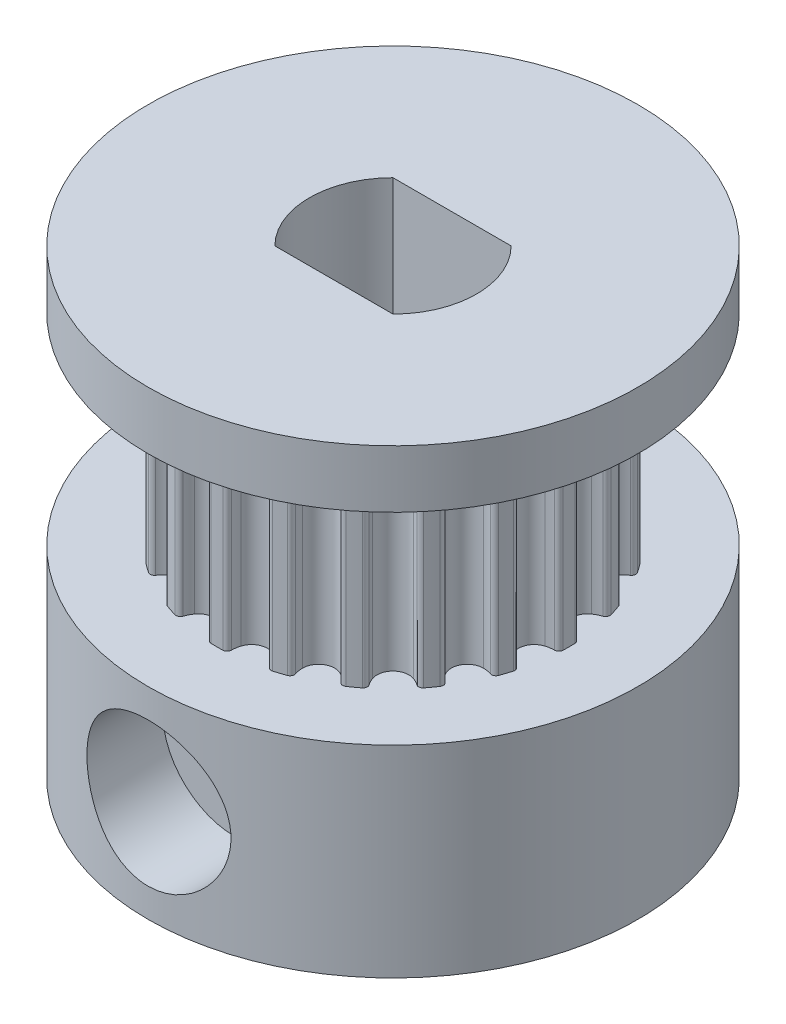
from build123d import *

# Parameters (mm, degrees)
GEAR_DEPTH              = 3.5
SKETCH2_R               = 8.5
BASE_DEPTH              = 7
NUT_PASSTHROUGH_DEPTH   = 4.2
TOP_START               = 2
SKETCH9_R               = 8.5
TOP_DEPTH               = 2
SHAFT_HOLE_DEPTH        = 16.016657418
SKETCH10_R              = 1.4
SCREW_HOLE_DEPTH        = 16.9608897
SCREW_START             = 5.5
SKETCH10_3_R            = 2.5
SKETCH10_3_R_2          = 1.4
SCREW_COUNTERBORE_DEPTH = 11.460889892


with BuildPart() as part:
    # Sketch1 → Gear (new, symmetric)
    with BuildSketch(Plane(origin=(0, 0, 0), x_dir=(1, 0, 0), z_dir=(0, 1, 0))):
        with BuildLine():
            ThreePointArc((0.83678283, 5.283238861), (0.559451844, 5.412576285), (0.392824337, 5.669239329))
            ThreePointArc((0.392824337, 5.669239329), (0.360319412, 5.812613334), (0.349186496, 5.959203693))
            ThreePointArc((0.349186496, 5.959203693), (0.306893857, 6.063268803), (0.204198113, 6.108785816))
            ThreePointArc((0.204198113, 6.108785816), (0, 6.112197724), (-0.204198113, 6.108785816))
            ThreePointArc((-0.204198113, 6.108785816), (-0.306893857, 6.063268803), (-0.349186496, 5.959203693))
            ThreePointArc((-0.349186496, 5.959203693), (-0.360319412, 5.812613334), (-0.392824337, 5.669239329))
            ThreePointArc((-0.392824337, 5.669239329), (-0.559451844, 5.412576285), (-0.83678283, 5.283238861))
            ThreePointArc((-0.83678283, 5.283238861), (-1.140507733, 5.320546073), (-1.378293153, 5.513156403))
            ThreePointArc((-1.378293153, 5.513156403), (-1.453512177, 5.63946861), (-1.509399121, 5.775444066))
            ThreePointArc((-1.509399121, 5.775444066), (-1.581779699, 5.861346723), (-1.693514686, 5.872901244))
            ThreePointArc((-1.693514686, 5.872901244), (-1.88877297, 5.813045474), (-2.081922578, 5.74669987))
            ThreePointArc((-2.081922578, 5.74669987), (-2.165526505, 5.671675888), (-2.173591307, 5.559634943))
            ThreePointArc((-2.173591307, 5.559634943), (-2.138880426, 5.416778966), (-2.125489443, 5.270377611))
            ThreePointArc((-2.125489443, 5.270377611), (-2.204648378, 4.974785818), (-2.428438357, 4.766078631))
            ThreePointArc((-2.428438357, 4.766078631), (-2.728826467, 4.707703741), (-3.014493705, 4.817407315))
            ThreePointArc((-3.014493705, 4.817407315), (-3.125063867, 4.914293405), (-3.220234237, 5.026343734))
            ThreePointArc((-3.220234237, 5.026343734), (-3.315617637, 5.085675187), (-3.425454468, 5.062136179))
            ThreePointArc((-3.425454468, 5.062136179), (-3.592659681, 4.944871831), (-3.755853956, 4.822086901))
            ThreePointArc((-3.755853956, 4.822086901), (-3.812182329, 4.72489982), (-3.785229856, 4.615850388))
            ThreePointArc((-3.785229856, 4.615850388), (-3.708072922, 4.490712533), (-3.650096834, 4.355614611))
            ThreePointArc((-3.650096834, 4.355614611), (-3.634038567, 4.050028654), (-3.782381417, 3.782381417))
            ThreePointArc((-3.782381417, 3.782381417), (-4.050028654, 3.634038567), (-4.355614611, 3.650096834))
            ThreePointArc((-4.355614611, 3.650096834), (-4.490712533, 3.708072922), (-4.615850388, 3.785229856))
            ThreePointArc((-4.615850388, 3.785229856), (-4.72489982, 3.812182329), (-4.822086901, 3.755853956))
            ThreePointArc((-4.822086901, 3.755853956), (-4.944871831, 3.592659681), (-5.062136179, 3.425454468))
            ThreePointArc((-5.062136179, 3.425454468), (-5.085675187, 3.315617637), (-5.026343734, 3.220234237))
            ThreePointArc((-5.026343734, 3.220234237), (-4.914293405, 3.125063867), (-4.817407315, 3.014493705))
            ThreePointArc((-4.817407315, 3.014493705), (-4.707703741, 2.728826467), (-4.766078631, 2.428438357))
            ThreePointArc((-4.766078631, 2.428438357), (-4.974785818, 2.204648378), (-5.270377611, 2.125489443))
            ThreePointArc((-5.270377611, 2.125489443), (-5.416778966, 2.138880426), (-5.559634943, 2.173591307))
            ThreePointArc((-5.559634943, 2.173591307), (-5.671675888, 2.165526505), (-5.74669987, 2.081922578))
            ThreePointArc((-5.74669987, 2.081922578), (-5.813045474, 1.88877297), (-5.872901244, 1.693514686))
            ThreePointArc((-5.872901244, 1.693514686), (-5.861346723, 1.581779699), (-5.775444066, 1.509399121))
            ThreePointArc((-5.775444066, 1.509399121), (-5.63946861, 1.453512177), (-5.513156403, 1.378293153))
            ThreePointArc((-5.513156403, 1.378293153), (-5.320546073, 1.140507733), (-5.283238861, 0.83678283))
            ThreePointArc((-5.283238861, 0.83678283), (-5.412576285, 0.559451844), (-5.669239329, 0.392824337))
            ThreePointArc((-5.669239329, 0.392824337), (-5.812613334, 0.360319412), (-5.959203693, 0.349186496))
            ThreePointArc((-5.959203693, 0.349186496), (-6.063268803, 0.306893857), (-6.108785816, 0.204198113))
            ThreePointArc((-6.108785816, 0.204198113), (-6.112197724, 0), (-6.108785816, -0.204198113))
            ThreePointArc((-6.108785816, -0.204198113), (-6.063268803, -0.306893857), (-5.959203693, -0.349186496))
            ThreePointArc((-5.959203693, -0.349186496), (-5.812613334, -0.360319412), (-5.669239329, -0.392824337))
            ThreePointArc((-5.669239329, -0.392824337), (-5.412576285, -0.559451844), (-5.283238861, -0.83678283))
            ThreePointArc((-5.283238861, -0.83678283), (-5.320546073, -1.140507733), (-5.513156403, -1.378293153))
            ThreePointArc((-5.513156403, -1.378293153), (-5.63946861, -1.453512177), (-5.775444066, -1.509399121))
            ThreePointArc((-5.775444066, -1.509399121), (-5.861346723, -1.581779699), (-5.872901244, -1.693514686))
            ThreePointArc((-5.872901244, -1.693514686), (-5.813045474, -1.88877297), (-5.74669987, -2.081922578))
            ThreePointArc((-5.74669987, -2.081922578), (-5.671675888, -2.165526505), (-5.559634943, -2.173591307))
            ThreePointArc((-5.559634943, -2.173591307), (-5.416778966, -2.138880426), (-5.270377611, -2.125489443))
            ThreePointArc((-5.270377611, -2.125489443), (-4.974785818, -2.204648378), (-4.766078631, -2.428438357))
            ThreePointArc((-4.766078631, -2.428438357), (-4.707703741, -2.728826467), (-4.817407315, -3.014493705))
            ThreePointArc((-4.817407315, -3.014493705), (-4.914293405, -3.125063867), (-5.026343734, -3.220234237))
            ThreePointArc((-5.026343734, -3.220234237), (-5.085675187, -3.315617637), (-5.062136179, -3.425454468))
            ThreePointArc((-5.062136179, -3.425454468), (-4.944871831, -3.592659681), (-4.822086901, -3.755853956))
            ThreePointArc((-4.822086901, -3.755853956), (-4.72489982, -3.812182329), (-4.615850388, -3.785229856))
            ThreePointArc((-4.615850388, -3.785229856), (-4.490712533, -3.708072922), (-4.355614611, -3.650096834))
            ThreePointArc((-4.355614611, -3.650096834), (-4.050028654, -3.634038567), (-3.782381417, -3.782381417))
            ThreePointArc((-3.782381417, -3.782381417), (-3.634038567, -4.050028654), (-3.650096834, -4.355614611))
            ThreePointArc((-3.650096834, -4.355614611), (-3.708072922, -4.490712533), (-3.785229856, -4.615850388))
            ThreePointArc((-3.785229856, -4.615850388), (-3.812182329, -4.72489982), (-3.755853956, -4.822086901))
            ThreePointArc((-3.755853956, -4.822086901), (-3.592659681, -4.944871831), (-3.425454468, -5.062136179))
            ThreePointArc((-3.425454468, -5.062136179), (-3.315617637, -5.085675187), (-3.220234237, -5.026343734))
            ThreePointArc((-3.220234237, -5.026343734), (-3.125063867, -4.914293405), (-3.014493705, -4.817407315))
            ThreePointArc((-3.014493705, -4.817407315), (-2.728826467, -4.707703741), (-2.428438357, -4.766078631))
            ThreePointArc((-2.428438357, -4.766078631), (-2.204648378, -4.974785818), (-2.125489443, -5.270377611))
            ThreePointArc((-2.125489443, -5.270377611), (-2.138880426, -5.416778966), (-2.173591307, -5.559634943))
            ThreePointArc((-2.173591307, -5.559634943), (-2.165526505, -5.671675888), (-2.081922578, -5.74669987))
            ThreePointArc((-2.081922578, -5.74669987), (-1.88877297, -5.813045474), (-1.693514686, -5.872901244))
            ThreePointArc((-1.693514686, -5.872901244), (-1.581779699, -5.861346723), (-1.509399121, -5.775444066))
            ThreePointArc((-1.509399121, -5.775444066), (-1.453512177, -5.63946861), (-1.378293153, -5.513156403))
            ThreePointArc((-1.378293153, -5.513156403), (-1.140507733, -5.320546073), (-0.83678283, -5.283238861))
            ThreePointArc((-0.83678283, -5.283238861), (-0.559451844, -5.412576285), (-0.392824337, -5.669239329))
            ThreePointArc((-0.392824337, -5.669239329), (-0.360319412, -5.812613334), (-0.349186496, -5.959203693))
            ThreePointArc((-0.349186496, -5.959203693), (-0.306893857, -6.063268803), (-0.204198113, -6.108785816))
            ThreePointArc((-0.204198113, -6.108785816), (0, -6.112197724), (0.204198113, -6.108785816))
            ThreePointArc((0.204198113, -6.108785816), (0.306893857, -6.063268803), (0.349186496, -5.959203693))
            ThreePointArc((0.349186496, -5.959203693), (0.360319412, -5.812613334), (0.392824337, -5.669239329))
            ThreePointArc((0.392824337, -5.669239329), (0.559451844, -5.412576285), (0.83678283, -5.283238861))
            ThreePointArc((0.83678283, -5.283238861), (1.140507733, -5.320546073), (1.378293153, -5.513156403))
            ThreePointArc((1.378293153, -5.513156403), (1.453512177, -5.63946861), (1.509399121, -5.775444066))
            ThreePointArc((1.509399121, -5.775444066), (1.581779699, -5.861346723), (1.693514686, -5.872901244))
            ThreePointArc((1.693514686, -5.872901244), (1.88877297, -5.813045474), (2.081922578, -5.74669987))
            ThreePointArc((2.081922578, -5.74669987), (2.165526505, -5.671675888), (2.173591307, -5.559634943))
            ThreePointArc((2.173591307, -5.559634943), (2.138880426, -5.416778966), (2.125489443, -5.270377611))
            ThreePointArc((2.125489443, -5.270377611), (2.204648378, -4.974785818), (2.428438357, -4.766078631))
            ThreePointArc((2.428438357, -4.766078631), (2.728826467, -4.707703741), (3.014493705, -4.817407315))
            ThreePointArc((3.014493705, -4.817407315), (3.125063867, -4.914293405), (3.220234237, -5.026343734))
            ThreePointArc((3.220234237, -5.026343734), (3.315617637, -5.085675187), (3.425454468, -5.062136179))
            ThreePointArc((3.425454468, -5.062136179), (3.592659681, -4.944871831), (3.755853956, -4.822086901))
            ThreePointArc((3.755853956, -4.822086901), (3.812182329, -4.72489982), (3.785229856, -4.615850388))
            ThreePointArc((3.785229856, -4.615850388), (3.708072922, -4.490712533), (3.650096834, -4.355614611))
            ThreePointArc((3.650096834, -4.355614611), (3.634038567, -4.050028654), (3.782381417, -3.782381417))
            ThreePointArc((3.782381417, -3.782381417), (4.050028654, -3.634038567), (4.355614611, -3.650096834))
            ThreePointArc((4.355614611, -3.650096834), (4.490712533, -3.708072922), (4.615850388, -3.785229856))
            ThreePointArc((4.615850388, -3.785229856), (4.72489982, -3.812182329), (4.822086901, -3.755853956))
            ThreePointArc((4.822086901, -3.755853956), (4.944871831, -3.592659681), (5.062136179, -3.425454468))
            ThreePointArc((5.062136179, -3.425454468), (5.085675187, -3.315617637), (5.026343734, -3.220234237))
            ThreePointArc((5.026343734, -3.220234237), (4.914293405, -3.125063867), (4.817407315, -3.014493705))
            ThreePointArc((4.817407315, -3.014493705), (4.707703741, -2.728826467), (4.766078631, -2.428438357))
            ThreePointArc((4.766078631, -2.428438357), (4.974785818, -2.204648378), (5.270377611, -2.125489443))
            ThreePointArc((5.270377611, -2.125489443), (5.416778966, -2.138880426), (5.559634943, -2.173591307))
            ThreePointArc((5.559634943, -2.173591307), (5.671675888, -2.165526505), (5.74669987, -2.081922578))
            ThreePointArc((5.74669987, -2.081922578), (5.813045474, -1.88877297), (5.872901244, -1.693514686))
            ThreePointArc((5.872901244, -1.693514686), (5.861346723, -1.581779699), (5.775444066, -1.509399121))
            ThreePointArc((5.775444066, -1.509399121), (5.63946861, -1.453512177), (5.513156403, -1.378293153))
            ThreePointArc((5.513156403, -1.378293153), (5.320546073, -1.140507733), (5.283238861, -0.83678283))
            ThreePointArc((5.283238861, -0.83678283), (5.412576285, -0.559451844), (5.669239329, -0.392824337))
            ThreePointArc((5.669239329, -0.392824337), (5.812613334, -0.360319412), (5.959203693, -0.349186496))
            ThreePointArc((5.959203693, -0.349186496), (6.063268803, -0.306893857), (6.108785816, -0.204198113))
            ThreePointArc((6.108785816, -0.204198113), (6.112197724, 0), (6.108785816, 0.204198113))
            ThreePointArc((6.108785816, 0.204198113), (6.063268803, 0.306893857), (5.959203693, 0.349186496))
            ThreePointArc((5.959203693, 0.349186496), (5.812613334, 0.360319412), (5.669239329, 0.392824337))
            ThreePointArc((5.669239329, 0.392824337), (5.412576285, 0.559451844), (5.283238861, 0.83678283))
            ThreePointArc((5.283238861, 0.83678283), (5.320546073, 1.140507733), (5.513156403, 1.378293153))
            ThreePointArc((5.513156403, 1.378293153), (5.63946861, 1.453512177), (5.775444066, 1.509399121))
            ThreePointArc((5.775444066, 1.509399121), (5.861346723, 1.581779699), (5.872901244, 1.693514686))
            ThreePointArc((5.872901244, 1.693514686), (5.813045474, 1.88877297), (5.74669987, 2.081922578))
            ThreePointArc((5.74669987, 2.081922578), (5.671675888, 2.165526505), (5.559634943, 2.173591307))
            ThreePointArc((5.559634943, 2.173591307), (5.416778966, 2.138880426), (5.270377611, 2.125489443))
            ThreePointArc((5.270377611, 2.125489443), (4.974785818, 2.204648378), (4.766078631, 2.428438357))
            ThreePointArc((4.766078631, 2.428438357), (4.707703741, 2.728826467), (4.817407315, 3.014493705))
            ThreePointArc((4.817407315, 3.014493705), (4.914293405, 3.125063867), (5.026343734, 3.220234237))
            ThreePointArc((5.026343734, 3.220234237), (5.085675187, 3.315617637), (5.062136179, 3.425454468))
            ThreePointArc((5.062136179, 3.425454468), (4.944871831, 3.592659681), (4.822086901, 3.755853956))
            ThreePointArc((4.822086901, 3.755853956), (4.72489982, 3.812182329), (4.615850388, 3.785229856))
            ThreePointArc((4.615850388, 3.785229856), (4.490712533, 3.708072922), (4.355614611, 3.650096834))
            ThreePointArc((4.355614611, 3.650096834), (4.050028654, 3.634038567), (3.782381417, 3.782381417))
            ThreePointArc((3.782381417, 3.782381417), (3.634038567, 4.050028654), (3.650096834, 4.355614611))
            ThreePointArc((3.650096834, 4.355614611), (3.708072922, 4.490712533), (3.785229856, 4.615850388))
            ThreePointArc((3.785229856, 4.615850388), (3.812182329, 4.72489982), (3.755853956, 4.822086901))
            ThreePointArc((3.755853956, 4.822086901), (3.592659681, 4.944871831), (3.425454468, 5.062136179))
            ThreePointArc((3.425454468, 5.062136179), (3.315617637, 5.085675187), (3.220234237, 5.026343734))
            ThreePointArc((3.220234237, 5.026343734), (3.125063867, 4.914293405), (3.014493705, 4.817407315))
            ThreePointArc((3.014493705, 4.817407315), (2.728826467, 4.707703741), (2.428438357, 4.766078631))
            ThreePointArc((2.428438357, 4.766078631), (2.204648378, 4.974785818), (2.125489443, 5.270377611))
            ThreePointArc((2.125489443, 5.270377611), (2.138880426, 5.416778966), (2.173591307, 5.559634943))
            ThreePointArc((2.173591307, 5.559634943), (2.165526505, 5.671675888), (2.081922578, 5.74669987))
            ThreePointArc((2.081922578, 5.74669987), (1.88877297, 5.813045474), (1.693514686, 5.872901244))
            ThreePointArc((1.693514686, 5.872901244), (1.581779699, 5.861346723), (1.509399121, 5.775444066))
            ThreePointArc((1.509399121, 5.775444066), (1.453512177, 5.63946861), (1.378293153, 5.513156403))
            ThreePointArc((1.378293153, 5.513156403), (1.140507733, 5.320546073), (0.83678283, 5.283238861))
        make_face()
    extrude(amount=GEAR_DEPTH, both=True)

    # Sketch2 → Base (add)
    with BuildSketch(Plane.XZ.offset(3.5)):
        Circle(SKETCH2_R)
        with BuildLine():
            ThreePointArc((2.05121915, 2.05), (2.9, 0), (2.05121915, -2.05))
            Line((2.05121915, -2.05), (-2.05121915, -2.05))
            ThreePointArc((-2.05121915, -2.05), (-2.9, 0), (-2.05121915, 2.05))
            Line((-2.05121915, 2.05), (2.05121915, 2.05))
        make_face(mode=Mode.SUBTRACT)
    extrude(amount=BASE_DEPTH)

    # Sketch3 → Nut Passthrough (cut)
    with BuildSketch(Plane.XY):
        Polygon((-2.65, -5.470021787), (-2.65, -10.5), (2.65, -10.5), (2.65, -5.470021787), (0, -3.940043573), align=None)
    extrude(amount=NUT_PASSTHROUGH_DEPTH, mode=Mode.SUBTRACT)

    # Sketch9 → Top (add)
    with BuildSketch(Plane(origin=(0, 3.5, 0), x_dir=(1, 0, 0), z_dir=(0, 1, 0)).offset(TOP_START)):
        Circle(SKETCH9_R)
    extrude(amount=-TOP_DEPTH)

    # Sketch2<4> → Shaft Hole (cut, through all)
    with BuildSketch(Plane.XZ.offset(3.5)):
        with BuildLine():
            ThreePointArc((-2.05121915, 2.05), (-2.9, 0), (-2.05121915, -2.05))
            Line((-2.05121915, -2.05), (2.05121915, -2.05))
            ThreePointArc((2.05121915, -2.05), (2.9, 0), (2.05121915, 2.05))
            Line((2.05121915, 2.05), (-2.05121915, 2.05))
        make_face()
    extrude(amount=-SHAFT_HOLE_DEPTH, mode=Mode.SUBTRACT)

    # Sketch10 → Screw Hole (cut, through all)
    with BuildSketch(Plane.XY):
        with Locations((0, -7)):
            Circle(SKETCH10_R)
    extrude(amount=SCREW_HOLE_DEPTH, mode=Mode.SUBTRACT)

    # Sketch10<3> → Screw Counterbore (cut, through all)
    with BuildSketch(Plane.XY.offset(SCREW_START)):
        with Locations((0, -7)):
            Circle(SKETCH10_3_R)
        with Locations((0, -7)):
            Circle(SKETCH10_3_R_2, mode=Mode.SUBTRACT)
    extrude(amount=SCREW_COUNTERBORE_DEPTH, mode=Mode.SUBTRACT)


solid = part.part
